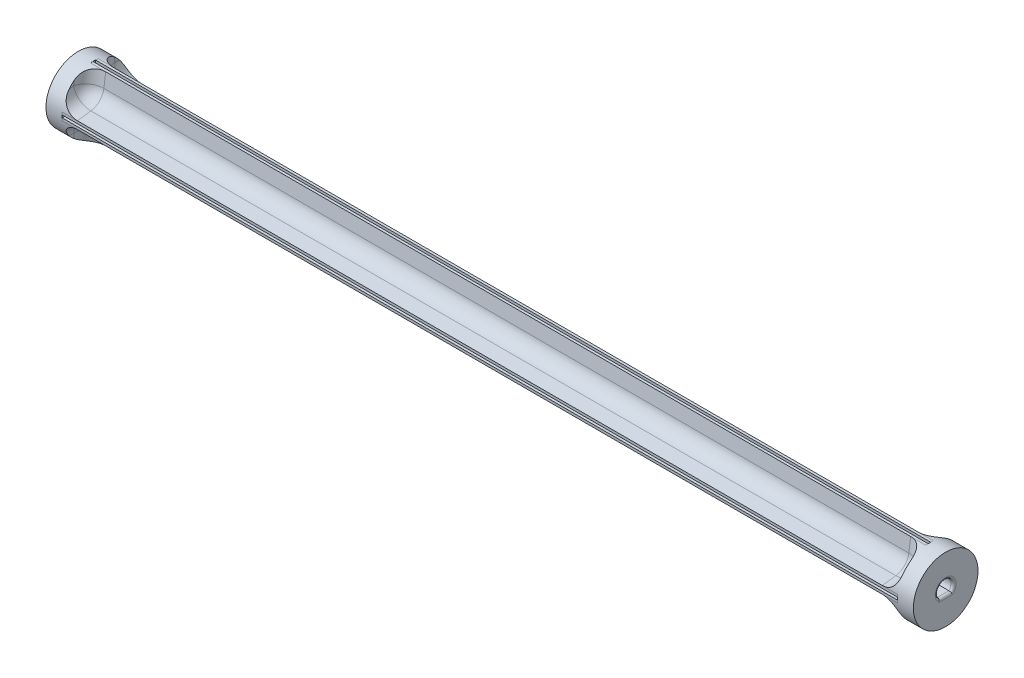
from build123d import *

# Parameters (mm, degrees)
BOSS_EXTRUDE1_DEPTH  = 82.55
FILLET2_R            = 3
SKETCH2_R            = 6.389248782
BOSS_EXTRUDE2_DEPTH  = 3.175
FILLET3_R            = 3
FILLET3_OF_MIRROR1_R = 3
CUT_EXTRUDE1_DEPTH   = 10
FILLET4_R            = 0.5
SKETCH4_R            = 1.5
CUT_EXTRUDE2_DEPTH   = 25


with BuildPart() as part:
    # Sketch1 → Boss-Extrude1 (new, symmetric)
    with BuildSketch(Plane(origin=(0, 0, 0), x_dir=(0, 0, -1), z_dir=(1, 0, 0))):
        with BuildLine():
            Line((1.984313483, 0.25), (6.345076832, 0.25))
            Line((6.345076832, 0.25), (6.345076832, 0.75))
            Line((6.345076832, 0.75), (1.414213562, 1.414213562))
            Line((1.414213562, 1.414213562), (0.75, 6.345076832))
            Line((0.75, 6.345076832), (0.25, 6.345076832))
            Line((0.25, 6.345076832), (0.25, 1.984313483))
            ThreePointArc((0.25, 1.984313483), (0, 2), (-0.25, 1.984313483))
            Line((-0.25, 1.984313483), (-0.25, 6.345076832))
            Line((-0.25, 6.345076832), (-0.75, 6.345076832))
            Line((-0.75, 6.345076832), (-1.414213562, 1.414213562))
            Line((-1.414213562, 1.414213562), (-6.345076832, 0.75))
            Line((-6.345076832, 0.75), (-6.345076832, 0.25))
            Line((-6.345076832, 0.25), (-1.984313483, 0.25))
            ThreePointArc((-1.984313483, 0.25), (-2, 0), (-1.984313483, -0.25))
            Line((-1.984313483, -0.25), (-6.345076832, -0.25))
            Line((-6.345076832, -0.25), (-6.345076832, -0.75))
            Line((-6.345076832, -0.75), (-1.414213562, -1.414213562))
            Line((-1.414213562, -1.414213562), (-0.75, -6.345076832))
            Line((-0.75, -6.345076832), (-0.25, -6.345076832))
            Line((-0.25, -6.345076832), (-0.25, -1.984313483))
            ThreePointArc((-0.25, -1.984313483), (0, -2), (0.25, -1.984313483))
            Line((0.25, -1.984313483), (0.25, -6.345076832))
            Line((0.25, -6.345076832), (0.75, -6.345076832))
            Line((0.75, -6.345076832), (1.414213562, -1.414213562))
            Line((1.414213562, -1.414213562), (6.345076832, -0.75))
            Line((6.345076832, -0.75), (6.345076832, -0.25))
            Line((6.345076832, -0.25), (1.984313483, -0.25))
            ThreePointArc((1.984313483, -0.25), (2, 0), (1.984313483, 0.25))
        make_face()
    extrude(amount=BOSS_EXTRUDE1_DEPTH, both=True)

    # Fillet2
    fillet2_edges = [part.edges().sort_by_distance(p)[0] for p in [
        (0, 1.414213562, -1.414213562),
        (0, -1.414213562, 1.414213562),
        (0, -1.414213562, -1.414213562),
        (0, 1.414213562, 1.414213562),
    ]]
    fillet(fillet2_edges, radius=FILLET2_R)

    # Sketch2 → Boss-Extrude2 (add)
    with BuildSketch(Plane(origin=(82.55, 0, 0), x_dir=(0, 0, -1), z_dir=(1, 0, 0))):
        with Locations(Location((0, 0, 0), (0, 0, 173.258810372))):
            Circle(SKETCH2_R)
    boss_extrude2 = extrude(amount=BOSS_EXTRUDE2_DEPTH)

    # Fillet3
    # the kernel refuses this fillet: 3 mm, written as the material it adds along each edge
    with BuildSketch(Plane(origin=(82.55, 0.251246738, 13.77794337), x_dir=(-1, 0, 0), z_dir=(0, -0.13349956500909602, -0.9910488717224707))) as fillet3_piece_1_section:
        with BuildLine():
            CenterArc((FILLET3_R, -FILLET3_R), FILLET3_R, 90, 90)
            Line((0, -FILLET3_R), (0, 0))
            Line((0, 0), (FILLET3_R, 0))
        make_face()
    fillet3_piece_1 = extrude(amount=10.187682285, mode=Mode.PRIVATE)
    fillet3_piece_1 = split(fillet3_piece_1, bisect_by=Plane(origin=(81.827283578, -1.538209406, 6.345076832), z_dir=(0, 0, -1)), keep=Keep.TOP, mode=Mode.PRIVATE)
    fillet3_piece_1 = fillet3_piece_1 & Plane(origin=(81.827283578, 0, 0), x_dir=(0, 0.11738469193248771, 0.9930865189397725), z_dir=(-1, 0, 0)) * Cylinder(6.389248782, 33, mode=Mode.PRIVATE)
    add(fillet3_piece_1)
    with BuildSketch(Plane(origin=(82.55, -13.77794337, 0.251246738), x_dir=(0, -0.13349956500909604, -0.9910488717224707), z_dir=(0, 0.9910488717224707, -0.13349956500909604))) as fillet3_piece_2_section:
        with BuildLine():
            CenterArc((FILLET3_R, FILLET3_R), FILLET3_R, 180, 90)
            Line((0, FILLET3_R), (0, 0))
            Line((0, 0), (FILLET3_R, 0))
        make_face()
    fillet3_piece_2 = extrude(amount=10.187682285, mode=Mode.PRIVATE)
    fillet3_piece_2 = fillet3_piece_2 & Plane(origin=(81.827283096, 0, 0), x_dir=(0, 0.11738469193248771, 0.9930865189397725), z_dir=(-1, 0, 0)) * Cylinder(6.389248782, 33, mode=Mode.PRIVATE)
    fillet3_piece_2 = split(fillet3_piece_2, bisect_by=Plane(origin=(81.827283096, -6.345076832, -1.538209957), z_dir=(0, 1, 0)), keep=Keep.TOP, mode=Mode.PRIVATE)
    add(fillet3_piece_2)
    with BuildSketch(Plane(origin=(82.55, -0.251246738, -13.77794337), x_dir=(-1, 0, 0), z_dir=(0, 0.13349956500909613, 0.9910488717224707))) as fillet3_piece_3_section:
        with BuildLine():
            CenterArc((FILLET3_R, -FILLET3_R), FILLET3_R, 90, 90)
            Line((0, -FILLET3_R), (0, 0))
            Line((0, 0), (FILLET3_R, 0))
        make_face()
    fillet3_piece_3 = extrude(amount=10.187682285, mode=Mode.PRIVATE)
    fillet3_piece_3 = split(fillet3_piece_3, bisect_by=Plane(origin=(81.827283578, 1.538209406, -6.345076832), z_dir=(0, 0, 1)), keep=Keep.TOP, mode=Mode.PRIVATE)
    fillet3_piece_3 = fillet3_piece_3 & Plane(origin=(81.827283578, 0, 0), x_dir=(0, 0.11738469193248771, 0.9930865189397725), z_dir=(-1, 0, 0)) * Cylinder(6.389248782, 33, mode=Mode.PRIVATE)
    add(fillet3_piece_3)
    with BuildSketch(Plane(origin=(82.55, 13.77794337, -0.251246738), x_dir=(-1, 0, 0), z_dir=(0, -0.9910488717224707, 0.13349956500909593))) as fillet3_piece_4_section:
        with BuildLine():
            CenterArc((FILLET3_R, -FILLET3_R), FILLET3_R, 90, 90)
            Line((0, -FILLET3_R), (0, 0))
            Line((0, 0), (FILLET3_R, 0))
        make_face()
    fillet3_piece_4 = extrude(amount=10.187682285, mode=Mode.PRIVATE)
    fillet3_piece_4 = split(fillet3_piece_4, bisect_by=Plane(origin=(81.827283578, 6.345076832, 1.538209406), z_dir=(0, -1, 0)), keep=Keep.TOP, mode=Mode.PRIVATE)
    fillet3_piece_4 = fillet3_piece_4 & Plane(origin=(81.827283578, 0, 0), x_dir=(0, 0.11738469193248771, 0.9930865189397725), z_dir=(-1, 0, 0)) * Cylinder(6.389248782, 33, mode=Mode.PRIVATE)
    add(fillet3_piece_4)
    with BuildSketch(Plane(origin=(82.55, -4.081951031, 4.081951031), x_dir=(0, 0.13349956500909585, -0.9910488717224707), z_dir=(0, -0.9910488717224707, -0.13349956500909585))) as fillet3_piece_5:
        with BuildLine():
            CenterArc((3 - FILLET3_R, -FILLET3_R), FILLET3_R, 0, 90)
            Line((3 - FILLET3_R, 0), (3, 0))
            Line((3, 0), (3, -FILLET3_R))
        make_face()
    revolve(axis=Axis((82.55, -4.081951031, 4.081951031), (1, 0, 0)), revolution_arc=74.656268101)
    with BuildSketch(Plane(origin=(82.55, -4.081951031, -4.081951031), x_dir=(0, 0.9910488717224707, 0.13349956500909568), z_dir=(0, 0.13349956500909568, -0.9910488717224707))) as fillet3_piece_6:
        with BuildLine():
            CenterArc((3 - FILLET3_R, -FILLET3_R), FILLET3_R, 0, 90)
            Line((3 - FILLET3_R, 0), (3, 0))
            Line((3, 0), (3, -FILLET3_R))
        make_face()
    revolve(axis=Axis((82.55, -4.081951031, -4.081951031), (1, 0, 0)), revolution_arc=74.656268101)
    with BuildSketch(Plane(origin=(82.55, 4.081951031, -4.081951031), x_dir=(0, -0.133499565009096, 0.9910488717224707), z_dir=(0, 0.9910488717224707, 0.133499565009096))) as fillet3_piece_7:
        with BuildLine():
            CenterArc((3 - FILLET3_R, -FILLET3_R), FILLET3_R, 0, 90)
            Line((3 - FILLET3_R, 0), (3, 0))
            Line((3, 0), (3, -FILLET3_R))
        make_face()
    revolve(axis=Axis((82.55, 4.081951031, -4.081951031), (1, 0, 0)), revolution_arc=74.656268101)
    with BuildSketch(Plane(origin=(82.55, 4.081951031, 4.081951031), x_dir=(0, -0.9910488717224705, -0.13349956500909627), z_dir=(0, -0.13349956500909627, 0.9910488717224705))) as fillet3_piece_8:
        with BuildLine():
            CenterArc((3 - FILLET3_R, -FILLET3_R), FILLET3_R, 0, 90)
            Line((3 - FILLET3_R, 0), (3, 0))
            Line((3, 0), (3, -FILLET3_R))
        make_face()
    revolve(axis=Axis((82.55, 4.081951031, 4.081951031), (1, 0, 0)), revolution_arc=74.656268101)
    with BuildSketch(Plane(origin=(82.55, -1.108804416, -3.681452336), x_dir=(-1, 0, 0), z_dir=(0, 0.13349956500909613, -0.9910488717224707))) as fillet3_piece_9_section:
        with BuildLine():
            CenterArc((FILLET3_R, -FILLET3_R), FILLET3_R, 90, 90)
            Line((0, -FILLET3_R), (0, 0))
            Line((0, 0), (FILLET3_R, 0))
        make_face()
    fillet3_piece_9 = extrude(amount=10.187682285, mode=Mode.PRIVATE)
    fillet3_piece_9 = split(fillet3_piece_9, bisect_by=Plane(origin=(81.82728444, -1.538207008, -6.345076832), z_dir=(0, 0, 1)), keep=Keep.TOP, mode=Mode.PRIVATE)
    fillet3_piece_9 = fillet3_piece_9 & Plane(origin=(81.82728444, 0, 0), x_dir=(0, 0.11738469193248771, 0.9930865189397725), z_dir=(-1, 0, 0)) * Cylinder(6.389248782, 33, mode=Mode.PRIVATE)
    add(fillet3_piece_9)
    with BuildSketch(Plane(origin=(82.55, -3.681452336, 1.108804416), x_dir=(-1, 0, 0), z_dir=(0, -0.9910488717224707, -0.13349956500909615))) as fillet3_piece_10_section:
        with BuildLine():
            CenterArc((FILLET3_R, -FILLET3_R), FILLET3_R, 90, 90)
            Line((0, -FILLET3_R), (0, 0))
            Line((0, 0), (FILLET3_R, 0))
        make_face()
    fillet3_piece_10 = extrude(amount=10.187682285, mode=Mode.PRIVATE)
    fillet3_piece_10 = split(fillet3_piece_10, bisect_by=Plane(origin=(81.82728444, -6.345076832, 1.538207008), z_dir=(0, 1, 0)), keep=Keep.TOP, mode=Mode.PRIVATE)
    fillet3_piece_10 = fillet3_piece_10 & Plane(origin=(81.82728444, 0, 0), x_dir=(0, 0.11738469193248771, 0.9930865189397725), z_dir=(-1, 0, 0)) * Cylinder(6.389248782, 33, mode=Mode.PRIVATE)
    add(fillet3_piece_10)
    with BuildSketch(Plane(origin=(82.55, 3.681452336, -1.108804416), x_dir=(-1, 0, 0), z_dir=(0, 0.9910488717224707, 0.13349956500909604))) as fillet3_piece_11_section:
        with BuildLine():
            CenterArc((FILLET3_R, -FILLET3_R), FILLET3_R, 90, 90)
            Line((0, -FILLET3_R), (0, 0))
            Line((0, 0), (FILLET3_R, 0))
        make_face()
    fillet3_piece_11 = extrude(amount=10.187682285, mode=Mode.PRIVATE)
    fillet3_piece_11 = split(fillet3_piece_11, bisect_by=Plane(origin=(81.82728444, 6.345076832, -1.538207008), z_dir=(0, -1, 0)), keep=Keep.TOP, mode=Mode.PRIVATE)
    fillet3_piece_11 = fillet3_piece_11 & Plane(origin=(81.82728444, 0, 0), x_dir=(0, 0.11738469193248771, 0.9930865189397725), z_dir=(-1, 0, 0)) * Cylinder(6.389248782, 33, mode=Mode.PRIVATE)
    add(fillet3_piece_11)
    with BuildSketch(Plane(origin=(82.55, 1.108804416, 3.681452336), x_dir=(-1, 0, 0), z_dir=(0, -0.1334995650090962, 0.9910488717224707))) as fillet3_piece_12_section:
        with BuildLine():
            CenterArc((FILLET3_R, -FILLET3_R), FILLET3_R, 90, 90)
            Line((0, -FILLET3_R), (0, 0))
            Line((0, 0), (FILLET3_R, 0))
        make_face()
    fillet3_piece_12 = extrude(amount=10.187682285, mode=Mode.PRIVATE)
    fillet3_piece_12 = split(fillet3_piece_12, bisect_by=Plane(origin=(81.82728444, 1.538207008, 6.345076832), z_dir=(0, 0, -1)), keep=Keep.TOP, mode=Mode.PRIVATE)
    fillet3_piece_12 = fillet3_piece_12 & Plane(origin=(81.82728444, 0, 0), x_dir=(0, 0.11738469193248771, 0.9930865189397725), z_dir=(-1, 0, 0)) * Cylinder(6.389248782, 33, mode=Mode.PRIVATE)
    add(fillet3_piece_12)

    # Mirror1: Boss-Extrude2 across plane
    add(boss_extrude2.mirror(Plane(origin=(0, 0, 0), x_dir=(0, 0, 1), z_dir=(1, 0, 0))))

    # Fillet3 of Mirror1
    # the kernel refuses this fillet: 3 mm, written as the material it adds along each edge
    with BuildSketch(Plane(origin=(-82.55, 0.251246738, 13.77794337), x_dir=(0, -0.9910488717224707, 0.13349956500909602), z_dir=(0, -0.13349956500909602, -0.9910488717224707))) as fillet3_of_mirror1_piece_1_section:
        with BuildLine():
            CenterArc((FILLET3_OF_MIRROR1_R, -FILLET3_OF_MIRROR1_R), FILLET3_OF_MIRROR1_R, 90, 90)
            Line((0, -FILLET3_OF_MIRROR1_R), (0, 0))
            Line((0, 0), (FILLET3_OF_MIRROR1_R, 0))
        make_face()
    fillet3_of_mirror1_piece_1 = extrude(amount=10.187682285, mode=Mode.PRIVATE)
    fillet3_of_mirror1_piece_1 = split(fillet3_of_mirror1_piece_1, bisect_by=Plane(origin=(-81.827283096, -1.538209957, 6.345076832), z_dir=(0, 0, -1)), keep=Keep.TOP, mode=Mode.PRIVATE)
    fillet3_of_mirror1_piece_1 = fillet3_of_mirror1_piece_1 & Plane(origin=(-81.827283096, 0, 0), x_dir=(0, 0.11738469193248771, 0.9930865189397725), z_dir=(1, 0, 0)) * Cylinder(6.389248782, 33, mode=Mode.PRIVATE)
    add(fillet3_of_mirror1_piece_1)
    with BuildSketch(Plane(origin=(-82.55, -13.77794337, 0.251246738), x_dir=(0, -0.13349956500909604, -0.9910488717224707), z_dir=(0, 0.9910488717224707, -0.13349956500909604))) as fillet3_of_mirror1_piece_2_section:
        with BuildLine():
            CenterArc((FILLET3_OF_MIRROR1_R, -FILLET3_OF_MIRROR1_R), FILLET3_OF_MIRROR1_R, 90, 90)
            Line((0, -FILLET3_OF_MIRROR1_R), (0, 0))
            Line((0, 0), (FILLET3_OF_MIRROR1_R, 0))
        make_face()
    fillet3_of_mirror1_piece_2 = extrude(amount=10.187682285, mode=Mode.PRIVATE)
    fillet3_of_mirror1_piece_2 = fillet3_of_mirror1_piece_2 & Plane(origin=(-81.827283096, 0, 0), x_dir=(0, 0.11738469193248771, 0.9930865189397725), z_dir=(1, 0, 0)) * Cylinder(6.389248782, 33, mode=Mode.PRIVATE)
    fillet3_of_mirror1_piece_2 = split(fillet3_of_mirror1_piece_2, bisect_by=Plane(origin=(-81.827283096, -6.345076832, -1.538209957), z_dir=(0, 1, 0)), keep=Keep.TOP, mode=Mode.PRIVATE)
    add(fillet3_of_mirror1_piece_2)
    with BuildSketch(Plane(origin=(-82.55, -0.251246738, -13.77794337), x_dir=(0, 0.9910488717224707, -0.13349956500909613), z_dir=(0, 0.13349956500909613, 0.9910488717224707))) as fillet3_of_mirror1_piece_3_section:
        with BuildLine():
            CenterArc((FILLET3_OF_MIRROR1_R, -FILLET3_OF_MIRROR1_R), FILLET3_OF_MIRROR1_R, 90, 90)
            Line((0, -FILLET3_OF_MIRROR1_R), (0, 0))
            Line((0, 0), (FILLET3_OF_MIRROR1_R, 0))
        make_face()
    fillet3_of_mirror1_piece_3 = extrude(amount=10.187682285, mode=Mode.PRIVATE)
    fillet3_of_mirror1_piece_3 = fillet3_of_mirror1_piece_3 & Plane(origin=(-81.827283096, 0, 0), x_dir=(0, 0.11738469193248771, 0.9930865189397725), z_dir=(1, 0, 0)) * Cylinder(6.389248782, 33, mode=Mode.PRIVATE)
    fillet3_of_mirror1_piece_3 = split(fillet3_of_mirror1_piece_3, bisect_by=Plane(origin=(-81.827283096, 1.538209957, -6.345076832), z_dir=(0, 0, 1)), keep=Keep.TOP, mode=Mode.PRIVATE)
    add(fillet3_of_mirror1_piece_3)
    with BuildSketch(Plane(origin=(-82.55, 13.77794337, -0.251246738), x_dir=(0, 0.13349956500909593, 0.9910488717224707), z_dir=(0, -0.9910488717224707, 0.13349956500909593))) as fillet3_of_mirror1_piece_4_section:
        with BuildLine():
            CenterArc((FILLET3_OF_MIRROR1_R, -FILLET3_OF_MIRROR1_R), FILLET3_OF_MIRROR1_R, 90, 90)
            Line((0, -FILLET3_OF_MIRROR1_R), (0, 0))
            Line((0, 0), (FILLET3_OF_MIRROR1_R, 0))
        make_face()
    fillet3_of_mirror1_piece_4 = extrude(amount=10.187682285, mode=Mode.PRIVATE)
    fillet3_of_mirror1_piece_4 = fillet3_of_mirror1_piece_4 & Plane(origin=(-81.827283096, 0, 0), x_dir=(0, 0.11738469193248771, 0.9930865189397725), z_dir=(1, 0, 0)) * Cylinder(6.389248782, 33, mode=Mode.PRIVATE)
    fillet3_of_mirror1_piece_4 = split(fillet3_of_mirror1_piece_4, bisect_by=Plane(origin=(-81.827283096, 6.345076832, 1.538209957), z_dir=(0, -1, 0)), keep=Keep.TOP, mode=Mode.PRIVATE)
    add(fillet3_of_mirror1_piece_4)
    with BuildSketch(Plane(origin=(-82.55, -4.081951031, 4.081951031), x_dir=(0, 0.13349956500909585, -0.9910488717224707), z_dir=(0, -0.9910488717224707, -0.13349956500909585))) as fillet3_of_mirror1_piece_5:
        with BuildLine():
            CenterArc((3 - FILLET3_OF_MIRROR1_R, FILLET3_OF_MIRROR1_R), FILLET3_OF_MIRROR1_R, 270, 90)
            Line((3, FILLET3_OF_MIRROR1_R), (3, 0))
            Line((3, 0), (3 - FILLET3_OF_MIRROR1_R, 0))
        make_face()
    revolve(axis=Axis((-82.55, -4.081951031, 4.081951031), (1, 0, 0)), revolution_arc=74.656268101)
    with BuildSketch(Plane(origin=(-82.55, -4.081951031, -4.081951031), x_dir=(0, 0.9910488717224707, 0.13349956500909568), z_dir=(0, 0.13349956500909568, -0.9910488717224707))) as fillet3_of_mirror1_piece_6:
        with BuildLine():
            CenterArc((3 - FILLET3_OF_MIRROR1_R, FILLET3_OF_MIRROR1_R), FILLET3_OF_MIRROR1_R, 270, 90)
            Line((3, FILLET3_OF_MIRROR1_R), (3, 0))
            Line((3, 0), (3 - FILLET3_OF_MIRROR1_R, 0))
        make_face()
    revolve(axis=Axis((-82.55, -4.081951031, -4.081951031), (1, 0, 0)), revolution_arc=74.656268101)
    with BuildSketch(Plane(origin=(-82.55, 4.081951031, -4.081951031), x_dir=(0, -0.133499565009096, 0.9910488717224707), z_dir=(0, 0.9910488717224707, 0.133499565009096))) as fillet3_of_mirror1_piece_7:
        with BuildLine():
            CenterArc((3 - FILLET3_OF_MIRROR1_R, FILLET3_OF_MIRROR1_R), FILLET3_OF_MIRROR1_R, 270, 90)
            Line((3, FILLET3_OF_MIRROR1_R), (3, 0))
            Line((3, 0), (3 - FILLET3_OF_MIRROR1_R, 0))
        make_face()
    revolve(axis=Axis((-82.55, 4.081951031, -4.081951031), (1, 0, 0)), revolution_arc=74.656268101)
    with BuildSketch(Plane(origin=(-82.55, 4.081951031, 4.081951031), x_dir=(0, -0.9910488717224705, -0.13349956500909627), z_dir=(0, -0.13349956500909627, 0.9910488717224705))) as fillet3_of_mirror1_piece_8:
        with BuildLine():
            CenterArc((3 - FILLET3_OF_MIRROR1_R, FILLET3_OF_MIRROR1_R), FILLET3_OF_MIRROR1_R, 270, 90)
            Line((3 - FILLET3_OF_MIRROR1_R, 0), (3, 0))
            Line((3, 0), (3, FILLET3_OF_MIRROR1_R))
        make_face()
    revolve(axis=Axis((-82.55, 4.081951031, 4.081951031), (1, 0, 0)), revolution_arc=74.656268101)
    with BuildSketch(Plane(origin=(-82.55, -1.108804416, -3.681452336), x_dir=(0, -0.9910488717224707, -0.13349956500909613), z_dir=(0, 0.13349956500909613, -0.9910488717224707))) as fillet3_of_mirror1_piece_9_section:
        with BuildLine():
            CenterArc((FILLET3_OF_MIRROR1_R, -FILLET3_OF_MIRROR1_R), FILLET3_OF_MIRROR1_R, 90, 90)
            Line((0, -FILLET3_OF_MIRROR1_R), (0, 0))
            Line((0, 0), (FILLET3_OF_MIRROR1_R, 0))
        make_face()
    fillet3_of_mirror1_piece_9 = extrude(amount=10.187682285, mode=Mode.PRIVATE)
    fillet3_of_mirror1_piece_9 = fillet3_of_mirror1_piece_9 & Plane(origin=(-81.827283944, 0, 0), x_dir=(0, 0.11738469193248771, 0.9930865189397725), z_dir=(1, 0, 0)) * Cylinder(6.389248782, 33, mode=Mode.PRIVATE)
    fillet3_of_mirror1_piece_9 = split(fillet3_of_mirror1_piece_9, bisect_by=Plane(origin=(-81.827283944, -1.538207588, -6.345076832), z_dir=(0, 0, 1)), keep=Keep.TOP, mode=Mode.PRIVATE)
    add(fillet3_of_mirror1_piece_9)
    with BuildSketch(Plane(origin=(-82.55, -3.681452336, 1.108804416), x_dir=(0, -0.13349956500909615, 0.9910488717224707), z_dir=(0, -0.9910488717224707, -0.13349956500909615))) as fillet3_of_mirror1_piece_10_section:
        with BuildLine():
            CenterArc((FILLET3_OF_MIRROR1_R, -FILLET3_OF_MIRROR1_R), FILLET3_OF_MIRROR1_R, 90, 90)
            Line((0, -FILLET3_OF_MIRROR1_R), (0, 0))
            Line((0, 0), (FILLET3_OF_MIRROR1_R, 0))
        make_face()
    fillet3_of_mirror1_piece_10 = extrude(amount=10.187682285, mode=Mode.PRIVATE)
    fillet3_of_mirror1_piece_10 = fillet3_of_mirror1_piece_10 & Plane(origin=(-81.827283944, 0, 0), x_dir=(0, 0.11738469193248771, 0.9930865189397725), z_dir=(1, 0, 0)) * Cylinder(6.389248782, 33, mode=Mode.PRIVATE)
    fillet3_of_mirror1_piece_10 = split(fillet3_of_mirror1_piece_10, bisect_by=Plane(origin=(-81.827283944, -6.345076832, 1.538207588), z_dir=(0, 1, 0)), keep=Keep.TOP, mode=Mode.PRIVATE)
    add(fillet3_of_mirror1_piece_10)
    with BuildSketch(Plane(origin=(-82.55, 3.681452336, -1.108804416), x_dir=(0, 0.13349956500909604, -0.9910488717224707), z_dir=(0, 0.9910488717224707, 0.13349956500909604))) as fillet3_of_mirror1_piece_11_section:
        with BuildLine():
            CenterArc((FILLET3_OF_MIRROR1_R, -FILLET3_OF_MIRROR1_R), FILLET3_OF_MIRROR1_R, 90, 90)
            Line((0, -FILLET3_OF_MIRROR1_R), (0, 0))
            Line((0, 0), (FILLET3_OF_MIRROR1_R, 0))
        make_face()
    fillet3_of_mirror1_piece_11 = extrude(amount=10.187682285, mode=Mode.PRIVATE)
    fillet3_of_mirror1_piece_11 = fillet3_of_mirror1_piece_11 & Plane(origin=(-81.827283944, 0, 0), x_dir=(0, 0.11738469193248771, 0.9930865189397725), z_dir=(1, 0, 0)) * Cylinder(6.389248782, 33, mode=Mode.PRIVATE)
    fillet3_of_mirror1_piece_11 = split(fillet3_of_mirror1_piece_11, bisect_by=Plane(origin=(-81.827283944, 6.345076832, -1.538207588), z_dir=(0, -1, 0)), keep=Keep.TOP, mode=Mode.PRIVATE)
    add(fillet3_of_mirror1_piece_11)
    with BuildSketch(Plane(origin=(-82.55, 1.108804416, 3.681452336), x_dir=(1, 0, 0), z_dir=(0, -0.1334995650090962, 0.9910488717224707))) as fillet3_of_mirror1_piece_12_section:
        with BuildLine():
            CenterArc((FILLET3_OF_MIRROR1_R, FILLET3_OF_MIRROR1_R), FILLET3_OF_MIRROR1_R, 180, 90)
            Line((0, FILLET3_OF_MIRROR1_R), (0, 0))
            Line((0, 0), (FILLET3_OF_MIRROR1_R, 0))
        make_face()
    fillet3_of_mirror1_piece_12 = extrude(amount=10.187682285, mode=Mode.PRIVATE)
    fillet3_of_mirror1_piece_12 = split(fillet3_of_mirror1_piece_12, bisect_by=Plane(origin=(-81.82728444, 1.538207008, 6.345076832), z_dir=(0, 0, -1)), keep=Keep.TOP, mode=Mode.PRIVATE)
    fillet3_of_mirror1_piece_12 = fillet3_of_mirror1_piece_12 & Plane(origin=(-81.82728444, 0, 0), x_dir=(0, 0.11738469193248771, 0.9930865189397725), z_dir=(1, 0, 0)) * Cylinder(6.389248782, 33, mode=Mode.PRIVATE)
    add(fillet3_of_mirror1_piece_12)

    # Sketch3 → Cut-Extrude1 (cut)
    # profile 1 of 2: a face of its own
    with BuildSketch(Plane(origin=(85.725, 0, 0), x_dir=(0, 0, -1), z_dir=(1, 0, 0))):
        with BuildLine():
            Line((-1.142199738, -1.047797575), (1.142199738, -1.047797575))
            ThreePointArc((1.142199738, -1.047797575), (0, 1.55), (-1.142199738, -1.047797575))
        make_face()
        with BuildLine():
            ThreePointArc((1.12, -0.997797575), (0, 1.5), (-1.12, -0.997797575))
            Line((-1.12, -0.997797575), (1.12, -0.997797575))
        make_face(mode=Mode.SUBTRACT)
    # profile 2 of 2: a face of its own
    with BuildSketch(Plane(origin=(85.725, 0, 0), x_dir=(0, 0, -1), z_dir=(1, 0, 0))):
        with BuildLine():
            Line((-1.12, -0.997797575), (1.12, -0.997797575))
            ThreePointArc((1.12, -0.997797575), (0, 1.5), (-1.12, -0.997797575))
        make_face()
    extrude(amount=-CUT_EXTRUDE1_DEPTH, mode=Mode.SUBTRACT)

    # Fillet4
    fillet4_edges = [part.edges().sort_by_distance(p)[0] for p in [
        (85.725, -1.047797575, 0),
        (85.725, 1.55, 0),
    ]]
    fillet(fillet4_edges, radius=FILLET4_R)

    # Sketch4 → Cut-Extrude2 (cut)
    with BuildSketch(Plane.ZY.offset(85.725)):
        Circle(SKETCH4_R)
    extrude(amount=-CUT_EXTRUDE2_DEPTH, mode=Mode.SUBTRACT)


solid = part.part
